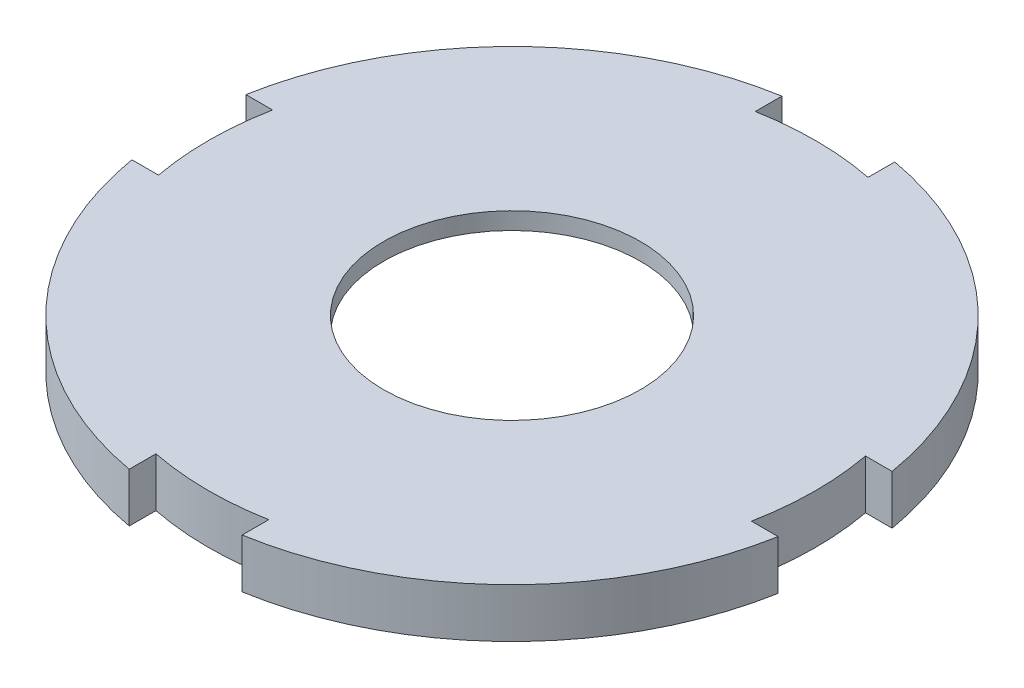
from build123d import *

# Parameters (mm, degrees)
SKETCH1_R           = 15.24
BOSS_EXTRUDE2_DEPTH = 5.842
CUT_EXTRUDE1_DEPTH  = 3.81
SKETCH3_R           = 31.75
CUT_EXTRUDE2_DEPTH  = 1.27


with BuildPart() as part:
    # Sketch1 → Boss-Extrude2 (new body)
    with BuildSketch(Plane(origin=(0, 0, 0), x_dir=(1, 0, 0), z_dir=(0, 1, 0))):
        with BuildLine():
            Line((35.405449863, 6.5405), (38.565312338, 6.5405))
            ThreePointArc((38.565312338, 6.5405), (27.795594479, 27.522107178), (6.9215, 38.498757042))
            Line((6.9215, 38.498757042), (6.9215, 35.332942957))
            ThreePointArc((6.9215, 35.332942957), (0.19391896, 36.003977776), (-6.5405, 35.405449863))
            Line((-6.5405, 35.405449863), (-6.5405, 38.565312338))
            ThreePointArc((-6.5405, 38.565312338), (-27.522107178, 27.795594479), (-38.498757042, 6.9215))
            Line((-38.498757042, 6.9215), (-35.332942957, 6.9215))
            ThreePointArc((-35.332942957, 6.9215), (-36.003977776, 0.19391896), (-35.405449863, -6.5405))
            Line((-35.405449863, -6.5405), (-38.565312338, -6.5405))
            ThreePointArc((-38.565312338, -6.5405), (-27.795594479, -27.522107178), (-6.9215, -38.498757042))
            Line((-6.9215, -38.498757042), (-6.9215, -35.332942957))
            ThreePointArc((-6.9215, -35.332942957), (-0.19391896, -36.003977776), (6.5405, -35.405449863))
            Line((6.5405, -35.405449863), (6.5405, -38.565312338))
            ThreePointArc((6.5405, -38.565312338), (27.522107178, -27.795594479), (38.498757042, -6.9215))
            Line((38.498757042, -6.9215), (35.332942957, -6.9215))
            ThreePointArc((35.332942957, -6.9215), (36.003977776, -0.19391896), (35.405449863, 6.5405))
        make_face()
        Circle(SKETCH1_R, mode=Mode.SUBTRACT)
    extrude(amount=BOSS_EXTRUDE2_DEPTH)

    # Sketch2 → Cut-Extrude1 (cut)
    with BuildSketch(Plane.XZ):
        with BuildLine():
            Line((17.377665752, -10.033), (-0.286554615, -40.628327152))
            ThreePointArc((-0.286554615, -40.628327152), (-2.416432138, -40.557415308), (-4.539661745, -40.374924792))
            Line((-4.539661745, -40.374924792), (8.196212586, -18.315743371))
            ThreePointArc((8.196212586, -18.315743371), (-13.440862054, 14.899247741), (17.377665752, -10.033))
        make_face()
    extrude(amount=-CUT_EXTRUDE1_DEPTH, mode=Mode.SUBTRACT)

    # Sketch3 → Cut-Extrude2 (cut)
    with BuildSketch(Plane.XZ):
        Circle(SKETCH3_R)
    extrude(amount=-CUT_EXTRUDE2_DEPTH, mode=Mode.SUBTRACT)


solid = part.part
